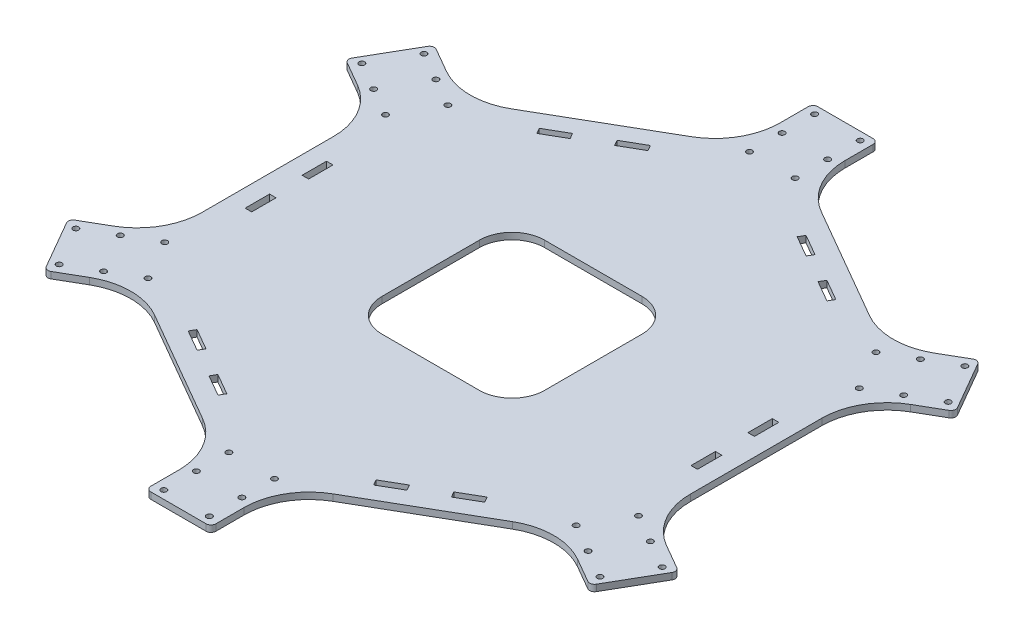
from build123d import *

# Parameters (mm, degrees)
SKETCH1_R           = 1.75
SKETCH1_W           = 4
SKETCH1_H           = 15
BOSS_EXTRUDE1_DEPTH = 2
FILLET1_R           = 3
CIRPATTERN3_START   = -2
CIRPATTERN3_DEPTH   = 4
CUT_EXTRUDE2_DEPTH  = 5


# Read off the part's stored shape, not the designer's step: CirPattern3
with BuildPart() as part:
    # Sketch1 → Boss-Extrude1 (new, symmetric)
    with BuildSketch(Plane(origin=(0, 0, 0), x_dir=(1, 0, 0), z_dir=(0, 1, 0))):
        with BuildLine():
            Line((109.999999797, 109.696551029), (40, 150.111069754))
            ThreePointArc((40, 150.111069754), (25.358983849, 164.752085906), (20, 184.752085906))
            Line((20, 184.752085906), (20, 205))
            Line((20, 205), (-20, 205))
            Line((-20, 205), (-20, 184.752085906))
            ThreePointArc((-20, 184.752085906), (-25.358983849, 164.752085906), (-40, 150.111069754))
            Line((-40, 150.111069754), (-109.999999797, 109.696551029))
            ThreePointArc((-109.999999797, 109.696551029), (-129.999999797, 104.33756718), (-149.999999797, 109.696551029))
            Line((-149.999999797, 109.696551029), (-167.535207776, 119.820508076))
            Line((-167.535207776, 119.820508076), (-187.535207776, 85.179491924))
            Line((-187.535207776, 85.179491924), (-169.999999797, 75.055534877))
            ThreePointArc((-169.999999797, 75.055534877), (-155.358983645, 60.414518726), (-149.999999797, 40.414518726))
            Line((-149.999999797, 40.414518726), (-149.999999797, -40.414518726))
            ThreePointArc((-149.999999797, -40.414518726), (-155.358983645, -60.414518726), (-169.999999797, -75.055534877))
            Line((-169.999999797, -75.055534877), (-187.535207776, -85.179491924))
            Line((-187.535207776, -85.179491924), (-167.535207776, -119.820508076))
            Line((-167.535207776, -119.820508076), (-149.999999797, -109.696551029))
            ThreePointArc((-149.999999797, -109.696551029), (-129.999999797, -104.33756718), (-109.999999797, -109.696551029))
            Line((-109.999999797, -109.696551029), (-40, -150.111069754))
            ThreePointArc((-40, -150.111069754), (-25.358983849, -164.752085906), (-20, -184.752085906))
            Line((-20, -184.752085906), (-20, -205))
            Line((-20, -205), (20, -205))
            Line((20, -205), (20, -184.752085906))
            ThreePointArc((20, -184.752085906), (25.358983849, -164.752085906), (40, -150.111069754))
            Line((40, -150.111069754), (109.999999797, -109.696551029))
            ThreePointArc((109.999999797, -109.696551029), (129.999999797, -104.33756718), (149.999999797, -109.696551029))
            Line((149.999999797, -109.696551029), (167.535207776, -119.820508076))
            Line((167.535207776, -119.820508076), (187.535207776, -85.179491924))
            Line((187.535207776, -85.179491924), (169.999999797, -75.055534877))
            ThreePointArc((169.999999797, -75.055534877), (155.358983645, -60.414518726), (149.999999797, -40.414518726))
            Line((149.999999797, -40.414518726), (149.999999797, 40.414518726))
            ThreePointArc((149.999999797, 40.414518726), (155.358983645, 60.414518726), (169.999999797, 75.055534877))
            Line((169.999999797, 75.055534877), (187.535207776, 85.179491924))
            Line((187.535207776, 85.179491924), (167.535207776, 119.820508076))
            Line((167.535207776, 119.820508076), (149.999999797, 109.696551029))
            ThreePointArc((149.999999797, 109.696551029), (129.999999797, 104.33756718), (109.999999797, 109.696551029))
        make_face()
        with Locations(Location((-14, 200, 0), (0, 0, 270))):
            Circle(SKETCH1_R, mode=Mode.SUBTRACT)
        with Locations(Location((-14, 180, 0), (0, 0, 270))):
            Circle(SKETCH1_R, mode=Mode.SUBTRACT)
        with Locations(Location((-14, 160, 0), (0, 0, 270))):
            Circle(SKETCH1_R, mode=Mode.SUBTRACT)
        with Locations(Location((14, 200, 0), (0, 0, 270))):
            Circle(SKETCH1_R, mode=Mode.SUBTRACT)
        with Locations(Location((14, 180, 0), (0, 0, 270))):
            Circle(SKETCH1_R, mode=Mode.SUBTRACT)
        with Locations(Location((14, 160, 0), (0, 0, 270))):
            Circle(SKETCH1_R, mode=Mode.SUBTRACT)
        with Locations(Location((145.564064606, 67.875644347, 0), (0, 0, 270))):
            Circle(SKETCH1_R, mode=Mode.SUBTRACT)
        with Locations(Location((131.564064606, 92.124355653, 0), (0, 0, 270))):
            Circle(SKETCH1_R, mode=Mode.SUBTRACT)
        with Locations(Location((162.884572681, 77.875644347, 0), (0, 0, 270))):
            Circle(SKETCH1_R, mode=Mode.SUBTRACT)
        with Locations(Location((180.205080757, 87.875644347, 0), (0, 0, 270))):
            Circle(SKETCH1_R, mode=Mode.SUBTRACT)
        with Locations(Location((166.205080757, 112.124355653, 0), (0, 0, 270))):
            Circle(SKETCH1_R, mode=Mode.SUBTRACT)
        with Locations(Location((148.884572681, 102.124355653, 0), (0, 0, 270))):
            Circle(SKETCH1_R, mode=Mode.SUBTRACT)
        with Locations(Location((131.564064606, -92.124355653, 0), (0, 0, 270))):
            Circle(SKETCH1_R, mode=Mode.SUBTRACT)
        with Locations(Location((145.564064606, -67.875644347, 0), (0, 0, 270))):
            Circle(SKETCH1_R, mode=Mode.SUBTRACT)
        with Locations(Location((148.884572681, -102.124355653, 0), (0, 0, 270))):
            Circle(SKETCH1_R, mode=Mode.SUBTRACT)
        with Locations(Location((166.205080757, -112.124355653, 0), (0, 0, 270))):
            Circle(SKETCH1_R, mode=Mode.SUBTRACT)
        with Locations(Location((180.205080757, -87.875644347, 0), (0, 0, 270))):
            Circle(SKETCH1_R, mode=Mode.SUBTRACT)
        with Locations(Location((162.884572681, -77.875644347, 0), (0, 0, 270))):
            Circle(SKETCH1_R, mode=Mode.SUBTRACT)
        with Locations(Location((-14, -160, 0), (0, 0, 270))):
            Circle(SKETCH1_R, mode=Mode.SUBTRACT)
        with Locations(Location((14, -160, 0), (0, 0, 270))):
            Circle(SKETCH1_R, mode=Mode.SUBTRACT)
        with Locations(Location((-14, -180, 0), (0, 0, 270))):
            Circle(SKETCH1_R, mode=Mode.SUBTRACT)
        with Locations(Location((-14, -200, 0), (0, 0, 270))):
            Circle(SKETCH1_R, mode=Mode.SUBTRACT)
        with Locations(Location((14, -200, 0), (0, 0, 270))):
            Circle(SKETCH1_R, mode=Mode.SUBTRACT)
        with Locations(Location((14, -180, 0), (0, 0, 270))):
            Circle(SKETCH1_R, mode=Mode.SUBTRACT)
        with Locations(Location((-145.564064606, -67.875644347, 0), (0, 0, 270))):
            Circle(SKETCH1_R, mode=Mode.SUBTRACT)
        with Locations(Location((-131.564064606, -92.124355653, 0), (0, 0, 270))):
            Circle(SKETCH1_R, mode=Mode.SUBTRACT)
        with Locations(Location((-162.884572681, -77.875644347, 0), (0, 0, 270))):
            Circle(SKETCH1_R, mode=Mode.SUBTRACT)
        with Locations(Location((-180.205080757, -87.875644347, 0), (0, 0, 270))):
            Circle(SKETCH1_R, mode=Mode.SUBTRACT)
        with Locations(Location((-166.205080757, -112.124355653, 0), (0, 0, 270))):
            Circle(SKETCH1_R, mode=Mode.SUBTRACT)
        with Locations(Location((-148.884572681, -102.124355653, 0), (0, 0, 270))):
            Circle(SKETCH1_R, mode=Mode.SUBTRACT)
        with Locations(Location((-131.564064606, 92.124355653, 0), (0, 0, 270))):
            Circle(SKETCH1_R, mode=Mode.SUBTRACT)
        with Locations(Location((-145.564064606, 67.875644347, 0), (0, 0, 270))):
            Circle(SKETCH1_R, mode=Mode.SUBTRACT)
        with Locations(Location((-148.884572681, 102.124355653, 0), (0, 0, 270))):
            Circle(SKETCH1_R, mode=Mode.SUBTRACT)
        with Locations(Location((-166.205080757, 112.124355653, 0), (0, 0, 270))):
            Circle(SKETCH1_R, mode=Mode.SUBTRACT)
        with Locations(Location((-180.205080757, 87.875644347, 0), (0, 0, 270))):
            Circle(SKETCH1_R, mode=Mode.SUBTRACT)
        with Locations(Location((-162.884572681, 77.875644347, 0), (0, 0, 270))):
            Circle(SKETCH1_R, mode=Mode.SUBTRACT)
        Polygon((89.150635095, -104.413429511), (76.160254038, -111.913429511), (78.160254038, -115.377531126), (91.150635095, -107.877531126), align=None, mode=Mode.SUBTRACT)
        with Locations((137, 17.5)):
            Rectangle(SKETCH1_W, SKETCH1_H, mode=Mode.SUBTRACT)
        with Locations((137, -17.5)):
            Rectangle(SKETCH1_W, SKETCH1_H, mode=Mode.SUBTRACT)
        Polygon((58.839745962, -121.913429511), (45.849364905, -129.413429511), (47.849364905, -132.877531126), (60.839745962, -125.377531126), align=None, mode=Mode.SUBTRACT)
        Polygon((-45.849364905, -129.413429511), (-58.839745962, -121.913429511), (-60.839745962, -125.377531126), (-47.849364905, -132.877531126), align=None, mode=Mode.SUBTRACT)
        Polygon((-76.160254038, -111.913429511), (-89.150635095, -104.413429511), (-91.150635095, -107.877531126), (-78.160254038, -115.377531126), align=None, mode=Mode.SUBTRACT)
        with Locations((-137, -17.5)):
            Rectangle(SKETCH1_W, SKETCH1_H, mode=Mode.SUBTRACT)
        with Locations((-137, 17.5)):
            Rectangle(SKETCH1_W, SKETCH1_H, mode=Mode.SUBTRACT)
        Polygon((-89.150635095, 104.413429511), (-76.160254038, 111.913429511), (-78.160254038, 115.377531126), (-91.150635095, 107.877531126), align=None, mode=Mode.SUBTRACT)
        Polygon((-58.839745962, 121.913429511), (-45.849364905, 129.413429511), (-47.849364905, 132.877531126), (-60.839745962, 125.377531126), align=None, mode=Mode.SUBTRACT)
        Polygon((45.849364905, 129.413429511), (58.839745962, 121.913429511), (60.839745962, 125.377531126), (47.849364905, 132.877531126), align=None, mode=Mode.SUBTRACT)
        Polygon((76.160254038, 111.913429511), (89.150635095, 104.413429511), (91.150635095, 107.877531126), (78.160254038, 115.377531126), align=None, mode=Mode.SUBTRACT)
    extrude(amount=BOSS_EXTRUDE1_DEPTH, both=True)

    # Fillet1
    fillet1_edges = [part.edges().sort_by_distance(p)[0] for p in [
        (-20, 0, -205),
        (20, 0, -205),
    ]]
    fillet(fillet1_edges, radius=FILLET1_R)

    # CirPattern3 outline → CirPattern3 (cut)
    with BuildSketch(Plane(origin=(0, 0, 0), x_dir=(1, 0, 0), z_dir=(0, 1, 0)).offset(CIRPATTERN3_START)):
        with BuildLine():
            Line((187.535207776, 85.179491924), (186.035207776, 87.777568136))
            ThreePointArc((186.035207776, 87.777568136), (186.334909043, 85.501111), (184.937131564, 83.679491924))
            Line((184.937131564, 83.679491924), (187.535207776, 85.179491924))
        make_face()
        with BuildLine():
            ThreePointArc((164.937131564, 118.320508076), (167.2135887, 118.620209343), (169.035207776, 117.222431864))
            Line((169.035207776, 117.222431864), (167.535207776, 119.820508076))
            Line((167.535207776, 119.820508076), (164.937131564, 118.320508076))
        make_face()
        with BuildLine():
            Line((167.535207776, -119.820508076), (169.035207776, -117.222431864))
            ThreePointArc((169.035207776, -117.222431864), (167.2135887, -118.620209343), (164.937131564, -118.320508076))
            Line((164.937131564, -118.320508076), (167.535207776, -119.820508076))
        make_face()
        with BuildLine():
            ThreePointArc((184.937131564, -83.679491924), (186.334909043, -85.501111), (186.035207776, -87.777568136))
            Line((186.035207776, -87.777568136), (187.535207776, -85.179491924))
            Line((187.535207776, -85.179491924), (184.937131564, -83.679491924))
        make_face()
        with BuildLine():
            Line((-20, -205), (-17, -205))
            ThreePointArc((-17, -205), (-19.121320344, -204.121320344), (-20, -202))
            Line((-20, -202), (-20, -205))
        make_face()
        with BuildLine():
            ThreePointArc((20, -202), (19.121320344, -204.121320344), (17, -205))
            Line((17, -205), (20, -205))
            Line((20, -205), (20, -202))
        make_face()
        with BuildLine():
            Line((-187.535207776, -85.179491924), (-186.035207776, -87.777568136))
            ThreePointArc((-186.035207776, -87.777568136), (-186.334909043, -85.501111), (-184.937131564, -83.679491924))
            Line((-184.937131564, -83.679491924), (-187.535207776, -85.179491924))
        make_face()
        with BuildLine():
            ThreePointArc((-164.937131564, -118.320508076), (-167.2135887, -118.620209343), (-169.035207776, -117.222431864))
            Line((-169.035207776, -117.222431864), (-167.535207776, -119.820508076))
            Line((-167.535207776, -119.820508076), (-164.937131564, -118.320508076))
        make_face()
        with BuildLine():
            Line((-167.535207776, 119.820508076), (-169.035207776, 117.222431864))
            ThreePointArc((-169.035207776, 117.222431864), (-167.2135887, 118.620209343), (-164.937131564, 118.320508076))
            Line((-164.937131564, 118.320508076), (-167.535207776, 119.820508076))
        make_face()
        with BuildLine():
            ThreePointArc((-184.937131564, 83.679491924), (-186.334909043, 85.501111), (-186.035207776, 87.777568136))
            Line((-186.035207776, 87.777568136), (-187.535207776, 85.179491924))
            Line((-187.535207776, 85.179491924), (-184.937131564, 83.679491924))
        make_face()
    extrude(amount=CIRPATTERN3_DEPTH, mode=Mode.SUBTRACT)

    # Sketch2 → Cut-Extrude2 (cut, symmetric)
    with BuildSketch(Plane(origin=(0, 2, 0), x_dir=(1, 0, 0), z_dir=(0, 1, 0))):
        with BuildLine():
            Line((-30, 50), (30, 50))
            ThreePointArc((30, 50), (44.142135624, 44.142135624), (50, 30))
            Line((50, 30), (50, -30))
            ThreePointArc((50, -30), (44.142135624, -44.142135624), (30, -50))
            Line((30, -50), (-30, -50))
            ThreePointArc((-30, -50), (-44.142135624, -44.142135624), (-50, -30))
            Line((-50, -30), (-50, 30))
            ThreePointArc((-50, 30), (-44.142135624, 44.142135624), (-30, 50))
        make_face()
    extrude(amount=CUT_EXTRUDE2_DEPTH, both=True, mode=Mode.SUBTRACT)


solid = part.part
